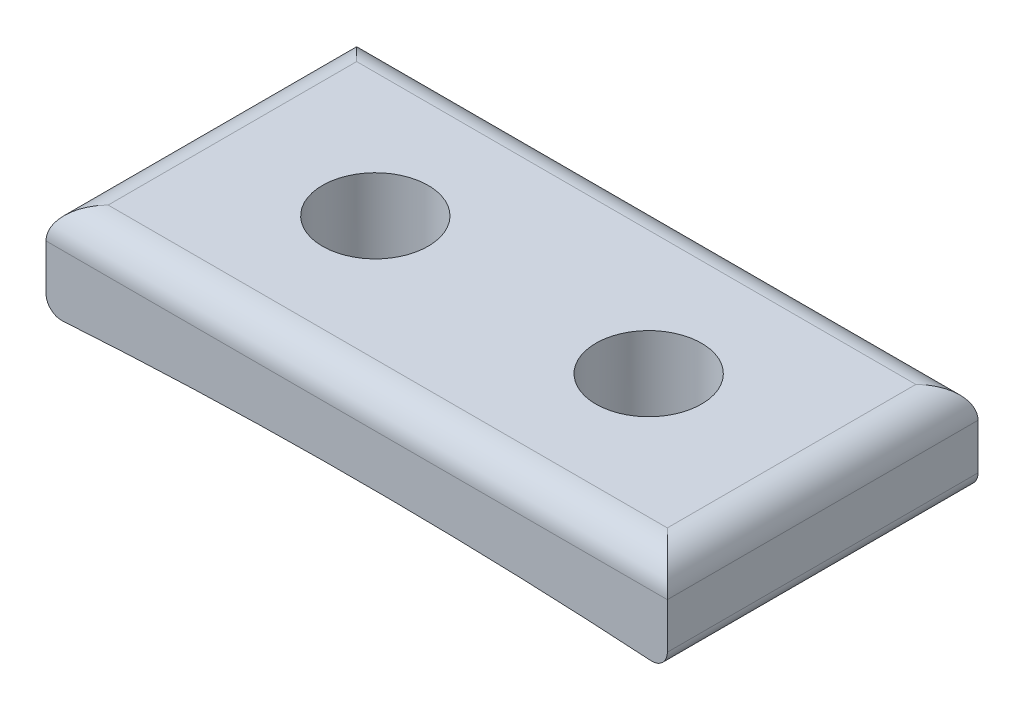
from build123d import *

# Parameters (mm, degrees)
SKETCH1_W            = 20
SKETCH1_H            = 10
BOSS_EXTRUDE1_DEPTH  = 3
M3_CLEARANCE_HOLE1_D = 3.4
FILLET3_R            = 1
CUT_EXTRUDE4_START   = -10
CUT_EXTRUDE4_DEPTH   = 10
FILLET4_R            = 0.5


# Read off the part's stored shape, not the designer's step: Cut-Extrude4
with BuildPart() as part:
    # Sketch1 → Boss-Extrude1 (new body)
    with BuildSketch(Plane(origin=(0, 0, 0), x_dir=(1, 0, 0), z_dir=(0, 1, 0))):
        with Locations((3.769230769, -2)):
            Rectangle(SKETCH1_W, SKETCH1_H)
    extrude(amount=BOSS_EXTRUDE1_DEPTH)

    # M3 Clearance Hole1 (through all)
    with Locations(Plane(origin=(0, 3, 0), x_dir=(1, 0, 0), z_dir=(0, 1, 0))):
        with Locations((-0.630769231, -2), (8.169230769, -2)):
            Hole(M3_CLEARANCE_HOLE1_D / 2)

    # Fillet3
    fillet3_edges = [part.edges().sort_by_distance(p)[0] for p in [
        (3.769230769, 3, 7),
        (13.769230769, 3, 2),
        (3.769230769, 3, -3),
        (-6.230769231, 3, 2),
    ]]
    fillet(fillet3_edges, radius=FILLET3_R)

    # Cut-Extrude4 outline → Cut-Extrude4 (cut)
    with BuildSketch(Plane.XY.offset(7).offset(CUT_EXTRUDE4_START)):
        with BuildLine():
            ThreePointArc((13.769230769, 0), (3.769230769, 0.339931125), (-6.230769231, 0))
            Line((-6.230769231, 0), (13.769230769, 0))
        make_face()
    extrude(amount=CUT_EXTRUDE4_DEPTH, mode=Mode.SUBTRACT)

    # Fillet4
    fillet4_edges = [part.edges().sort_by_distance(p)[0] for p in [
        (13.769230769, 0, 2),
        (-6.230769231, 0, 2),
    ]]
    fillet(fillet4_edges, radius=FILLET4_R)


solid = part.part
